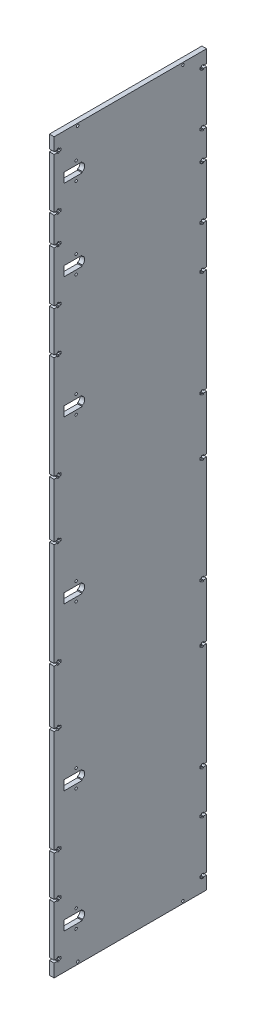
from build123d import *

# Parameters (mm, degrees)
SKETCH1_W           = 22.55
SKETCH1_H           = 11.95
SKETCH1_R           = 1.5
BOSS_EXTRUDE1_DEPTH = 5.8
SKETCH2_R           = 1.55
CUT_EXTRUDE1_DEPTH  = 5.8
CUT_EXTRUDE2_DEPTH  = 5.8


with BuildPart() as part:
    # Sketch1 → Boss-Extrude1 (new body)
    with BuildSketch(Plane(origin=(0, 0, 0), x_dir=(0, 0, -1), z_dir=(1, 0, 0))):
        Polygon((0, 16), (0, 0), (188.4, 0), (188.4, 16), (184.4, 16), (184.4, 14.79), (182.05, 14.79), (182.05, 16), (180.05, 16), (180.05, 19), (182.05, 19), (182.05, 20.21), (184.4, 20.21), (184.4, 19), (188.4, 19), (188.4, 81), (184.4, 81), (184.4, 79.79), (182.05, 79.79), (182.05, 81), (180.05, 81), (180.05, 84), (182.05, 84), (182.05, 85.21), (184.4, 85.21), (184.4, 84), (188.4, 84), (188.4, 133.5), (184.4, 133.5), (184.4, 132.29), (182.05, 132.29), (182.05, 133.5), (180.05, 133.5), (180.05, 136.5), (182.05, 136.5), (182.05, 137.71), (184.4, 137.71), (184.4, 136.5), (188.4, 136.5), (188.4, 263.5), (184.4, 263.5), (184.4, 262.29), (182.05, 262.29), (182.05, 263.5), (180.05, 263.5), (180.05, 266.5), (182.05, 266.5), (182.05, 267.71), (184.4, 267.71), (184.4, 266.5), (188.4, 266.5), (188.4, 333.5), (184.4, 333.5), (184.4, 332.29), (182.05, 332.29), (182.05, 333.5), (180.05, 333.5), (180.05, 336.5), (182.05, 336.5), (182.05, 337.71), (184.4, 337.71), (184.4, 336.5), (188.4, 336.5), (188.4, 463.5), (184.4, 463.5), (184.4, 462.29), (182.05, 462.29), (182.05, 463.5), (180.05, 463.5), (180.05, 466.5), (182.05, 466.5), (182.05, 467.71), (184.4, 467.71), (184.4, 466.5), (188.4, 466.5), (188.4, 533.5), (184.4, 533.5), (184.4, 532.29), (182.05, 532.29), (182.05, 533.5), (180.05, 533.5), (180.05, 536.5), (182.05, 536.5), (182.05, 537.71), (184.4, 537.71), (184.4, 536.5), (188.4, 536.5), (188.4, 663.5), (184.4, 663.5), (184.4, 662.29), (182.05, 662.29), (182.05, 663.5), (180.05, 663.5), (180.05, 666.5), (182.05, 666.5), (182.05, 667.71), (184.4, 667.71), (184.4, 666.5), (188.4, 666.5), (188.4, 716), (184.4, 716), (184.4, 714.79), (182.05, 714.79), (182.05, 716), (180.05, 716), (180.05, 719), (182.05, 719), (182.05, 720.21), (184.4, 720.21), (184.4, 719), (188.4, 719), (188.4, 781), (184.4, 781), (184.4, 779.79), (182.05, 779.79), (182.05, 781), (180.05, 781), (180.05, 784), (182.05, 784), (182.05, 785.21), (184.4, 785.21), (184.4, 784), (188.4, 784), (188.4, 816), (184.4, 816), (184.4, 814.79), (182.05, 814.79), (182.05, 816), (180.05, 816), (180.05, 819), (182.05, 819), (182.05, 820.21), (184.4, 820.21), (184.4, 819), (188.4, 819), (188.4, 881), (184.4, 881), (184.4, 879.79), (182.05, 879.79), (182.05, 881), (180.05, 881), (180.05, 884), (182.05, 884), (182.05, 885.21), (184.4, 885.21), (184.4, 884), (188.4, 884), (188.4, 900), (0, 900), (0, 884), (4, 884), (4, 885.21), (6.35, 885.21), (6.35, 884), (8.35, 884), (8.35, 881), (6.35, 881), (6.35, 879.79), (4, 879.79), (4, 881), (0, 881), (0, 819), (4, 819), (4, 820.21), (6.35, 820.21), (6.35, 819), (8.35, 819), (8.35, 816), (6.35, 816), (6.35, 814.79), (4, 814.79), (4, 816), (0, 816), (0, 784), (4, 784), (4, 785.21), (6.35, 785.21), (6.35, 784), (8.35, 784), (8.35, 781), (6.35, 781), (6.35, 779.79), (4, 779.79), (4, 781), (0, 781), (0, 719), (4, 719), (4, 720.21), (6.35, 720.21), (6.35, 719), (8.35, 719), (8.35, 716), (6.35, 716), (6.35, 714.79), (4, 714.79), (4, 716), (0, 716), (0, 666.5), (4, 666.5), (4, 667.71), (6.35, 667.71), (6.35, 666.5), (8.35, 666.5), (8.35, 663.5), (6.35, 663.5), (6.35, 662.29), (4, 662.29), (4, 663.5), (0, 663.5), (0, 536.5), (4, 536.5), (4, 537.71), (6.35, 537.71), (6.35, 536.5), (8.35, 536.5), (8.35, 533.5), (6.35, 533.5), (6.35, 532.29), (4, 532.29), (4, 533.5), (0, 533.5), (0, 466.5), (4, 466.5), (4, 467.71), (6.35, 467.71), (6.35, 466.5), (8.35, 466.5), (8.35, 463.5), (6.35, 463.5), (6.35, 462.29), (4, 462.29), (4, 463.5), (0, 463.5), (0, 336.5), (4, 336.5), (4, 337.71), (6.35, 337.71), (6.35, 336.5), (8.35, 336.5), (8.35, 333.5), (6.35, 333.5), (6.35, 332.29), (4, 332.29), (4, 333.5), (0, 333.5), (0, 266.5), (4, 266.5), (4, 267.71), (6.35, 267.71), (6.35, 266.5), (8.35, 266.5), (8.35, 263.5), (6.35, 263.5), (6.35, 262.29), (4, 262.29), (4, 263.5), (0, 263.5), (0, 136.5), (4, 136.5), (4, 137.71), (6.35, 137.71), (6.35, 136.5), (8.35, 136.5), (8.35, 133.5), (6.35, 133.5), (6.35, 132.29), (4, 132.29), (4, 133.5), (0, 133.5), (0, 84), (4, 84), (4, 85.21), (6.35, 85.21), (6.35, 84), (8.35, 84), (8.35, 81), (6.35, 81), (6.35, 79.79), (4, 79.79), (4, 81), (0, 81), (0, 19), (4, 19), (4, 20.21), (6.35, 20.21), (6.35, 19), (8.35, 19), (8.35, 16), (6.35, 16), (6.35, 14.79), (4, 14.79), (4, 16), align=None)
        with Locations((23.416011084, 50)):
            Rectangle(SKETCH1_W, SKETCH1_H, mode=Mode.SUBTRACT)
        with Locations((27.221011084, 39)):
            Circle(SKETCH1_R, mode=Mode.SUBTRACT)
        with Locations((27.221011084, 61)):
            Circle(SKETCH1_R, mode=Mode.SUBTRACT)
        with Locations((23.416011084, 200)):
            Rectangle(SKETCH1_W, SKETCH1_H, mode=Mode.SUBTRACT)
        with Locations((27.221011084, 189)):
            Circle(SKETCH1_R, mode=Mode.SUBTRACT)
        with Locations((27.221011084, 211)):
            Circle(SKETCH1_R, mode=Mode.SUBTRACT)
        with Locations((23.416011084, 400)):
            Rectangle(SKETCH1_W, SKETCH1_H, mode=Mode.SUBTRACT)
        with Locations((27.221011084, 389)):
            Circle(SKETCH1_R, mode=Mode.SUBTRACT)
        with Locations((27.221011084, 411)):
            Circle(SKETCH1_R, mode=Mode.SUBTRACT)
        with Locations((23.416011084, 600)):
            Rectangle(SKETCH1_W, SKETCH1_H, mode=Mode.SUBTRACT)
        with Locations((27.221011084, 589)):
            Circle(SKETCH1_R, mode=Mode.SUBTRACT)
        with Locations((27.221011084, 611)):
            Circle(SKETCH1_R, mode=Mode.SUBTRACT)
        with Locations((23.416011084, 750)):
            Rectangle(SKETCH1_W, SKETCH1_H, mode=Mode.SUBTRACT)
        with Locations((27.221011084, 739)):
            Circle(SKETCH1_R, mode=Mode.SUBTRACT)
        with Locations((27.221011084, 761)):
            Circle(SKETCH1_R, mode=Mode.SUBTRACT)
        with Locations((23.416011084, 850)):
            Rectangle(SKETCH1_W, SKETCH1_H, mode=Mode.SUBTRACT)
        with Locations((27.221011084, 839)):
            Circle(SKETCH1_R, mode=Mode.SUBTRACT)
        with Locations((27.221011084, 861)):
            Circle(SKETCH1_R, mode=Mode.SUBTRACT)
    extrude(amount=BOSS_EXTRUDE1_DEPTH)

    # Sketch2 → Cut-Extrude1 (cut)
    with BuildSketch(Plane(origin=(5.8, 0, 0), x_dir=(0, 0, -1), z_dir=(1, 0, 0))):
        with Locations((159.2, 897.1)):
            Circle(SKETCH2_R)
        with Locations((29.2, 897.1)):
            Circle(SKETCH2_R)
        with Locations((159.2, 2.9)):
            Circle(SKETCH2_R)
        with Locations((29.2, 2.9)):
            Circle(SKETCH2_R)
    extrude(amount=-CUT_EXTRUDE1_DEPTH, mode=Mode.SUBTRACT)

    # Sketch3 → Cut-Extrude2 (cut)
    with BuildSketch(Plane(origin=(5.8, 0, 0), x_dir=(0, 0, -1), z_dir=(1, 0, 0))):
        with BuildLine():
            Line((34.691011084, 745.5), (34.691011084, 754.5))
            add(Edge.make_bspline(
                [(34.691011084, 745.5), (37.691011084, 745.5), (37.691011084, 750), (37.691011084, 754.5), (34.691011084, 754.5)],
                knots=[3.141592654, 3.141592654, 3.141592654, 4.71238898, 4.71238898, 6.283185307, 6.283185307, 6.283185307], degree=2, weights=[1, 0.707106781, 1, 0.707106781, 1]))
        make_face()
        with BuildLine():
            Line((34.691011084, 845.5), (34.691011084, 854.5))
            add(Edge.make_bspline(
                [(34.691011084, 845.5), (37.691011084, 845.5), (37.691011084, 850), (37.691011084, 854.5), (34.691011084, 854.5)],
                knots=[3.141592654, 3.141592654, 3.141592654, 4.71238898, 4.71238898, 6.283185307, 6.283185307, 6.283185307], degree=2, weights=[1, 0.707106781, 1, 0.707106781, 1]))
        make_face()
        with BuildLine():
            Line((34.691011084, 595.5), (34.691011084, 604.5))
            add(Edge.make_bspline(
                [(34.691011084, 595.5), (37.691011084, 595.5), (37.691011084, 600), (37.691011084, 604.5), (34.691011084, 604.5)],
                knots=[3.141592654, 3.141592654, 3.141592654, 4.71238898, 4.71238898, 6.283185307, 6.283185307, 6.283185307], degree=2, weights=[1, 0.707106781, 1, 0.707106781, 1]))
        make_face()
        with BuildLine():
            Line((34.691011084, 395.5), (34.691011084, 404.5))
            add(Edge.make_bspline(
                [(34.691011084, 395.5), (37.691011084, 395.5), (37.691011084, 400), (37.691011084, 404.5), (34.691011084, 404.5)],
                knots=[3.141592654, 3.141592654, 3.141592654, 4.71238898, 4.71238898, 6.283185307, 6.283185307, 6.283185307], degree=2, weights=[1, 0.707106781, 1, 0.707106781, 1]))
        make_face()
        with BuildLine():
            Line((34.691011084, 195.5), (34.691011084, 204.5))
            add(Edge.make_bspline(
                [(34.691011084, 195.5), (37.691011084, 195.5), (37.691011084, 200), (37.691011084, 204.5), (34.691011084, 204.5)],
                knots=[0, 0, 0, 1.570796327, 1.570796327, 3.141592654, 3.141592654, 3.141592654], degree=2, weights=[1, 0.707106781, 1, 0.707106781, 1]))
        make_face()
        with BuildLine():
            Line((34.691011084, 45.5), (34.691011084, 54.5))
            add(Edge.make_bspline(
                [(34.691011084, 45.5), (37.691011084, 45.5), (37.691011084, 50), (37.691011084, 54.5), (34.691011084, 54.5)],
                knots=[3.141592654, 3.141592654, 3.141592654, 4.71238898, 4.71238898, 6.283185307, 6.283185307, 6.283185307], degree=2, weights=[1, 0.707106781, 1, 0.707106781, 1]))
        make_face()
    extrude(amount=-CUT_EXTRUDE2_DEPTH, mode=Mode.SUBTRACT)


solid = part.part
